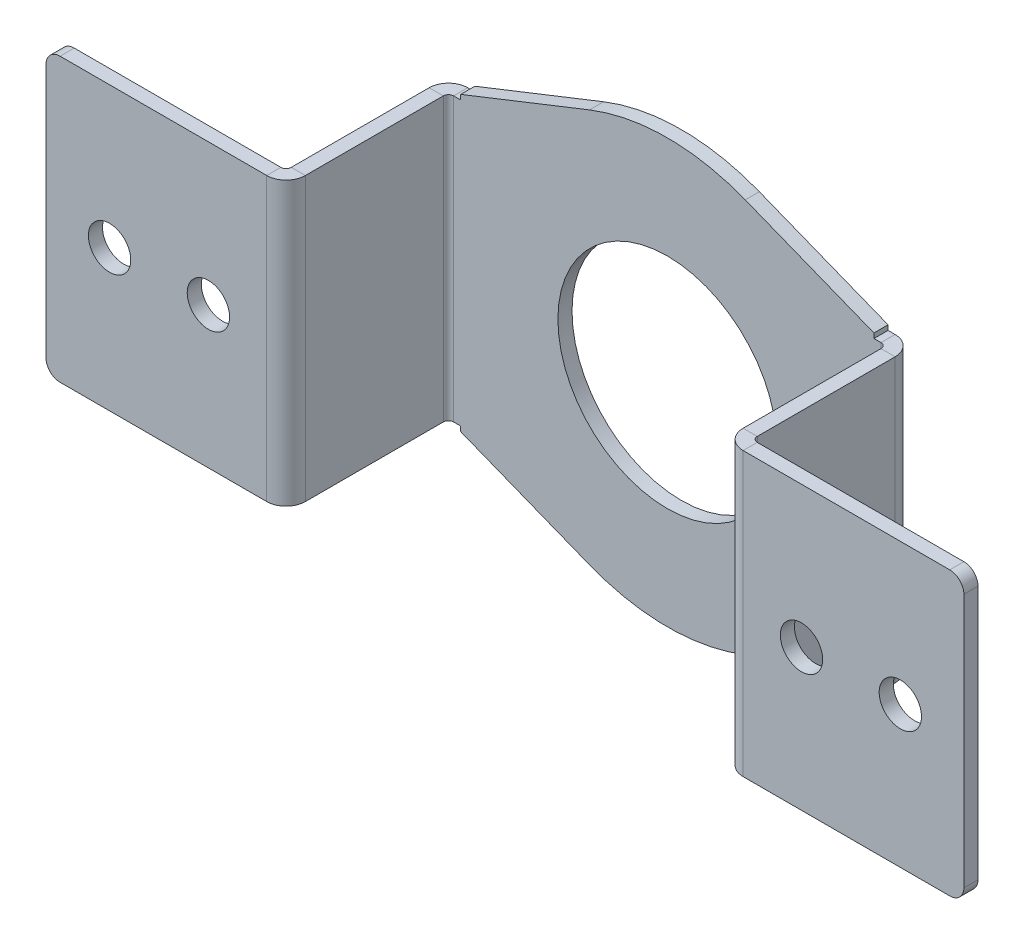
from build123d import *

# Parameters (mm, degrees)
SKETCH1_R                       = 15.5
BASE_FLANGE1_DEPTH              = 2
EDGE_FLANGE1_STRIP_W            = 9.4732
EDGE_FLANGE1_STRIP_H            = 2
EDGE_FLANGE1_STRIP_CUT_DEPTH    = 40
EDGE_FLANGE1_RELIEF_W           = 10.4732
EDGE_FLANGE1_RELIEF_H           = 1
EDGE_FLANGE1_RELIEF_CUT_DEPTH   = 2
EDGE_FLANGE1_STRIP_2_W          = 9.4732
EDGE_FLANGE1_STRIP_2_H          = 2
EDGE_FLANGE1_STRIP_CUT_2_DEPTH  = 40
EDGE_FLANGE1_RELIEF_2_W         = 10.4732
EDGE_FLANGE1_RELIEF_2_H         = 1
EDGE_FLANGE1_RELIEF_CUT_2_DEPTH = 2
EDGE_FLANGE1_DEPTH              = 40
EDGE_FLANGE1_BEND_DEPTH         = 40
EDGE_FLANGE2_STRIP_W            = 9.4732
EDGE_FLANGE2_STRIP_H            = 2
EDGE_FLANGE2_STRIP_CUT_DEPTH    = 40
EDGE_FLANGE2_STRIP_2_W          = 9.4732
EDGE_FLANGE2_STRIP_2_H          = 2
EDGE_FLANGE2_STRIP_CUT_2_DEPTH  = 40
EDGE_FLANGE2_DEPTH              = 40
EDGE_FLANGE2_BEND_DEPTH         = 40
SKETCH17_R                      = 3
CUT_EXTRUDE1_DEPTH              = 10
FILLET1_R                       = 2


# Sheet-metal steps are written as plain solids
with BuildPart() as part:
    # Sketch1 → Base-Flange1 (new body)
    with BuildSketch(Plane.XY):
        with BuildLine():
            Line((-31, 20), (-11.034132012, 27.897095382))
            ThreePointArc((-11.034132012, 27.897095382), (0, 30), (11.034132012, 27.897095382))
            Line((11.034132012, 27.897095382), (31, 20))
            Line((31, 20), (31, -20))
            Line((31, -20), (11.034132012, -27.897095382))
            ThreePointArc((11.034132012, -27.897095382), (0, -30), (-11.034132012, -27.897095382))
            Line((-11.034132012, -27.897095382), (-31, -20))
            Line((-31, -20), (-31, 20))
        make_face()
        Circle(SKETCH1_R, mode=Mode.SUBTRACT)
    extrude(amount=-BASE_FLANGE1_DEPTH)

    # Edge-Flange1 strip (across the edge) → Edge-Flange1 strip cut (cut)
    with BuildSketch(Plane(origin=(-31, 20, 0), x_dir=(1, 0, 0), z_dir=(0, -1, 0))):
        with Locations((-4, -1)):
            Rectangle(EDGE_FLANGE1_STRIP_W, EDGE_FLANGE1_STRIP_H)
    extrude(amount=EDGE_FLANGE1_STRIP_CUT_DEPTH, mode=Mode.SUBTRACT)

    # Edge-Flange1 relief (on the sheet) → Edge-Flange1 relief cut (cut)
    with BuildSketch(Plane(origin=(-30.2634, 20, 0), x_dir=(1, 0, 0), z_dir=(0, 0, 1))):
        with Locations((-4.2366, 0.5)):
            Rectangle(EDGE_FLANGE1_RELIEF_W, EDGE_FLANGE1_RELIEF_H)
        with Locations((-4.2366, -40.5)):
            Rectangle(EDGE_FLANGE1_RELIEF_W, EDGE_FLANGE1_RELIEF_H)
    extrude(amount=-EDGE_FLANGE1_RELIEF_CUT_DEPTH, mode=Mode.SUBTRACT)

    # Edge-Flange1 strip 2 (across the edge) → Edge-Flange1 strip cut 2 (cut)
    with BuildSketch(Plane(origin=(31, -20, 0), x_dir=(-1, 0, 0), z_dir=(0, 1, 0))):
        with Locations((-4, -1)):
            Rectangle(EDGE_FLANGE1_STRIP_2_W, EDGE_FLANGE1_STRIP_2_H)
    extrude(amount=EDGE_FLANGE1_STRIP_CUT_2_DEPTH, mode=Mode.SUBTRACT)

    # Edge-Flange1 relief 2 (on the sheet) → Edge-Flange1 relief cut 2 (cut)
    with BuildSketch(Plane(origin=(30.2634, -20, 0), x_dir=(-1, 0, 0), z_dir=(0, 0, 1))):
        with Locations((-4.2366, 0.5)):
            Rectangle(EDGE_FLANGE1_RELIEF_2_W, EDGE_FLANGE1_RELIEF_2_H)
        with Locations((-4.2366, -40.5)):
            Rectangle(EDGE_FLANGE1_RELIEF_2_W, EDGE_FLANGE1_RELIEF_2_H)
    extrude(amount=-EDGE_FLANGE1_RELIEF_CUT_2_DEPTH, mode=Mode.SUBTRACT)

    # Edge-Flange1 section (across the edge) → Edge-Flange1 (add)
    with BuildSketch(Plane(origin=(-31, 20, 0), x_dir=(1, 0, 0), z_dir=(0, -1, 0))):
        with BuildLine():
            Line((-2, 0.7366), (-2, 21))
            Line((-2, 21), (0, 21))
            Line((0, 21), (0, 0.7366))
            ThreePointArc((0, 0.7366), (0.215745145, 0.215745145), (0.7366, 0))
            Line((0.7366, 0), (0.7366, -2))
            ThreePointArc((0.7366, -2), (-1.198468417, -1.198468417), (-2, 0.7366))
        make_face()
    extrude(amount=EDGE_FLANGE1_DEPTH)

    # Edge-Flange1 section 2 (across the edge) → Edge-Flange1 bend (add)
    with BuildSketch(Plane(origin=(31, -20, 0), x_dir=(-1, 0, 0), z_dir=(0, 1, 0))):
        with BuildLine():
            Line((-2, 0.7366), (-2, 21))
            Line((-2, 21), (0, 21))
            Line((0, 21), (0, 0.7366))
            ThreePointArc((0, 0.7366), (0.215745145, 0.215745145), (0.7366, 0))
            Line((0.7366, 0), (0.7366, -2))
            ThreePointArc((0.7366, -2), (-1.198468417, -1.198468417), (-2, 0.7366))
        make_face()
    extrude(amount=EDGE_FLANGE1_BEND_DEPTH)

    # Edge-Flange2 strip (across the edge) → Edge-Flange2 strip cut (cut)
    with BuildSketch(Plane(origin=(-33, -20, 21), x_dir=(0, 0, -1), z_dir=(0, 1, 0))):
        with Locations((-4, -1)):
            Rectangle(EDGE_FLANGE2_STRIP_W, EDGE_FLANGE2_STRIP_H)
    extrude(amount=EDGE_FLANGE2_STRIP_CUT_DEPTH, mode=Mode.SUBTRACT)

    # Edge-Flange2 strip 2 (across the edge) → Edge-Flange2 strip cut 2 (cut)
    with BuildSketch(Plane(origin=(33, 20, 21), x_dir=(0, 0, -1), z_dir=(0, -1, 0))):
        with Locations((-4, -1)):
            Rectangle(EDGE_FLANGE2_STRIP_2_W, EDGE_FLANGE2_STRIP_2_H)
    extrude(amount=EDGE_FLANGE2_STRIP_CUT_2_DEPTH, mode=Mode.SUBTRACT)

    # Edge-Flange2 section (across the edge) → Edge-Flange2 (add)
    with BuildSketch(Plane(origin=(-33, -20, 21), x_dir=(0, 0, -1), z_dir=(0, 1, 0))):
        with BuildLine():
            Line((-2, 0.7366), (-2, 32))
            Line((-2, 32), (0, 32))
            Line((0, 32), (0, 0.7366))
            ThreePointArc((0, 0.7366), (0.215745145, 0.215745145), (0.7366, 0))
            Line((0.7366, 0), (0.7366, -2))
            ThreePointArc((0.7366, -2), (-1.198468417, -1.198468417), (-2, 0.7366))
        make_face()
    extrude(amount=EDGE_FLANGE2_DEPTH)

    # Edge-Flange2 section 2 (across the edge) → Edge-Flange2 bend (add)
    with BuildSketch(Plane(origin=(33, 20, 21), x_dir=(0, 0, -1), z_dir=(0, -1, 0))):
        with BuildLine():
            Line((-2, 0.7366), (-2, 32))
            Line((-2, 32), (0, 32))
            Line((0, 32), (0, 0.7366))
            ThreePointArc((0, 0.7366), (0.215745145, 0.215745145), (0.7366, 0))
            Line((0.7366, 0), (0.7366, -2))
            ThreePointArc((0.7366, -2), (-1.198468417, -1.198468417), (-2, 0.7366))
        make_face()
    extrude(amount=EDGE_FLANGE2_BEND_DEPTH)

    # Sketch17 → Cut-Extrude1 (cut)
    with BuildSketch(Plane(origin=(0, 0, 21), x_dir=(-1, 0, 0), z_dir=(0, 0, -1))):
        with Locations((56, 0)):
            Circle(SKETCH17_R)
        with Locations((42, 0)):
            Circle(SKETCH17_R)
        with Locations((-56, 0)):
            Circle(SKETCH17_R)
        with Locations((-42, 0)):
            Circle(SKETCH17_R)
    extrude(amount=-CUT_EXTRUDE1_DEPTH, mode=Mode.SUBTRACT)

    # Fillet1
    fillet1_edges = [part.edges().sort_by_distance(p)[0] for p in [
        (-65, -20, 22),
        (-65, 20, 22),
        (65, 20, 22),
        (65, -20, 22),
    ]]
    fillet(fillet1_edges, radius=FILLET1_R)


solid = part.part
